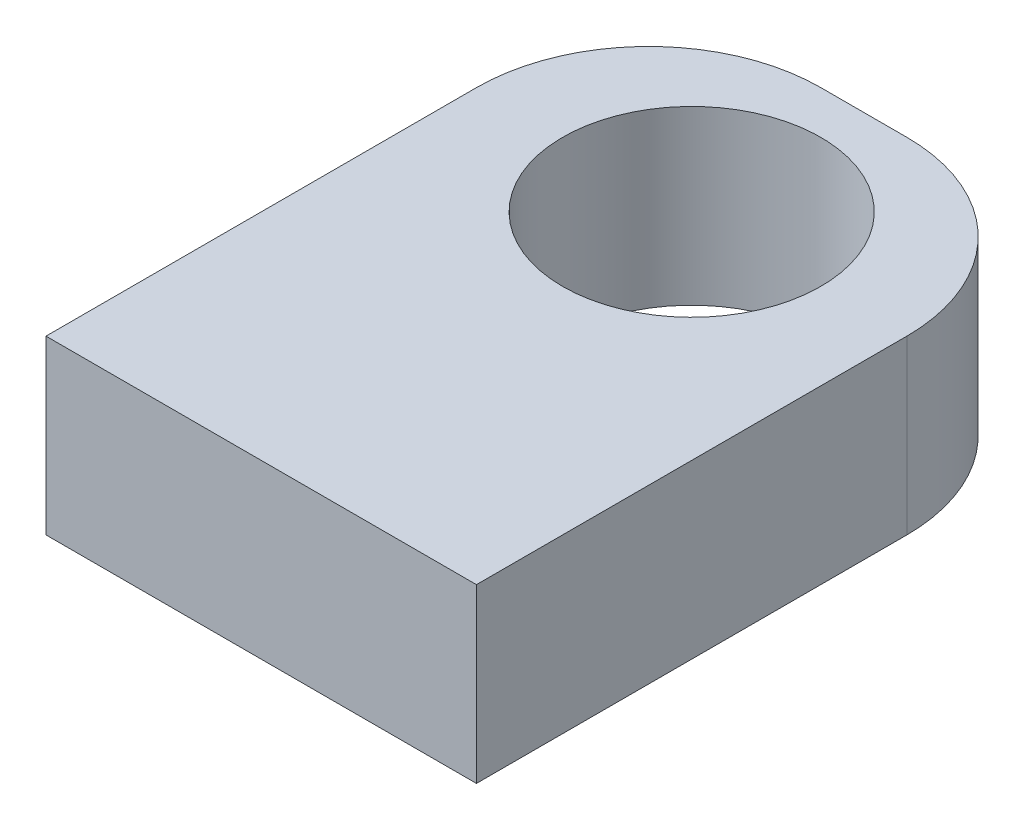
from build123d import *

# Parameters (mm, degrees)
STOCK_VARAV_UKSEGA_1_START = 312
STOCK_VARAV_UKSEGA_1_DEPTH = 10
TAB1_START                 = -10
SKETCH1_R                  = 7.5
TAB1_DEPTH                 = 10


# Read off the part's stored shape, not the designer's step: Stock-Varav_uksega-1
# Sheet-metal steps are written as plain solids
with BuildPart() as part:
    # Stock-Varav_uksega-1 outline → Stock-Varav_uksega-1 (new body)
    with BuildSketch(Plane(origin=(0, 0, 0), x_dir=(1, 0, 0), z_dir=(0, 1, 0)).offset(STOCK_VARAV_UKSEGA_1_START)):
        with BuildLine():
            Line((-11, 20), (-11, 50.267826876))
            ThreePointArc((-11, 50.267826876), (-12.117692031, 47.738612787), (-12.5, 45))
            Line((-12.5, 45), (-12.5, 20))
            Line((-12.5, 20), (-11, 20))
        make_face()
    extrude(amount=STOCK_VARAV_UKSEGA_1_DEPTH)

    # Sketch1 → Tab1 (add)
    with BuildSketch(Plane(origin=(0, 322, 0), x_dir=(1, 0, 0), z_dir=(0, 1, 0)).offset(TAB1_START)):
        with BuildLine():
            Line((-12.5, 20), (12.5, 20))
            Line((12.5, 20), (12.5, 45))
            ThreePointArc((12.5, 45), (9.571067812, 52.071067812), (2.5, 55))
            Line((2.5, 55), (-2.5, 55))
            ThreePointArc((-2.5, 55), (-9.571067812, 52.071067812), (-12.5, 45))
            Line((-12.5, 45), (-12.5, 20))
        make_face()
        with Locations(Location((0, 45, 0), (0, 0, 270))):
            Circle(SKETCH1_R, mode=Mode.SUBTRACT)
    extrude(amount=TAB1_DEPTH)


solid = part.part
